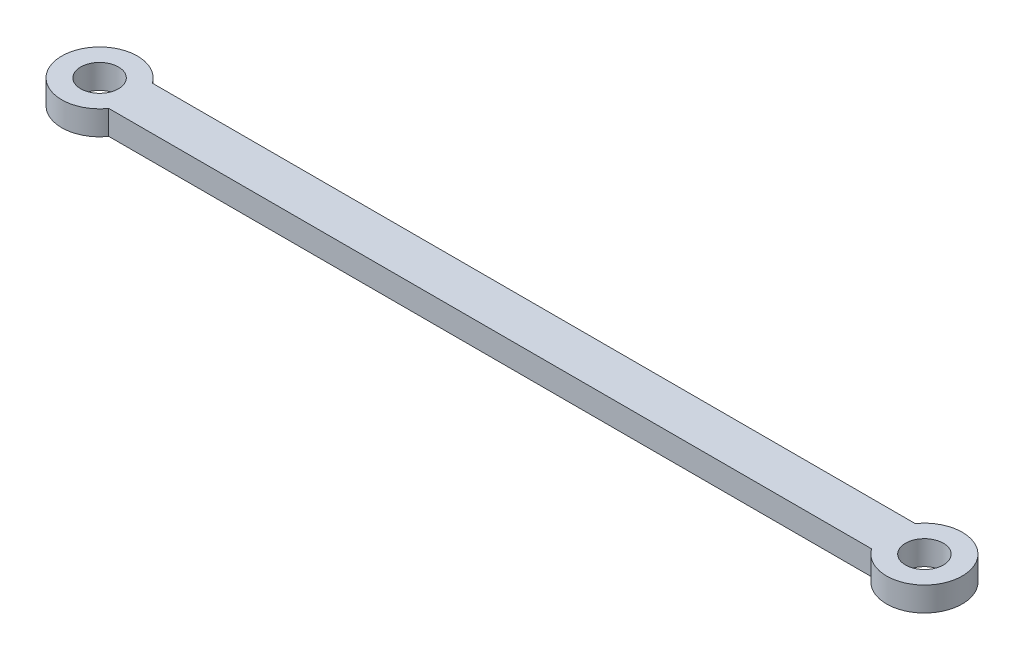
from build123d import *

# Parameters (mm, degrees)
SKETCH1_R           = 3.9
BOSS_EXTRUDE1_DEPTH = 5


with BuildPart() as part:
    # Sketch1 → Boss-Extrude1 (new body)
    with BuildSketch(Plane(origin=(0, 0, 0), x_dir=(1, 0, 0), z_dir=(0, 1, 0))):
        with BuildLine():
            Line((-78.616427333, -4.5), (78.616427333, -4.5))
            ThreePointArc((78.616427333, -4.5), (92.810249676, 0), (78.616427333, 4.5))
            Line((78.616427333, 4.5), (-78.616427333, 4.5))
            ThreePointArc((-78.616427333, 4.5), (-92.810249676, 0), (-78.616427333, -4.5))
        make_face()
        with Locations((85, 0)):
            Circle(SKETCH1_R, mode=Mode.SUBTRACT)
        with Locations((-85, 0)):
            Circle(SKETCH1_R, mode=Mode.SUBTRACT)
    extrude(amount=BOSS_EXTRUDE1_DEPTH)


solid = part.part
